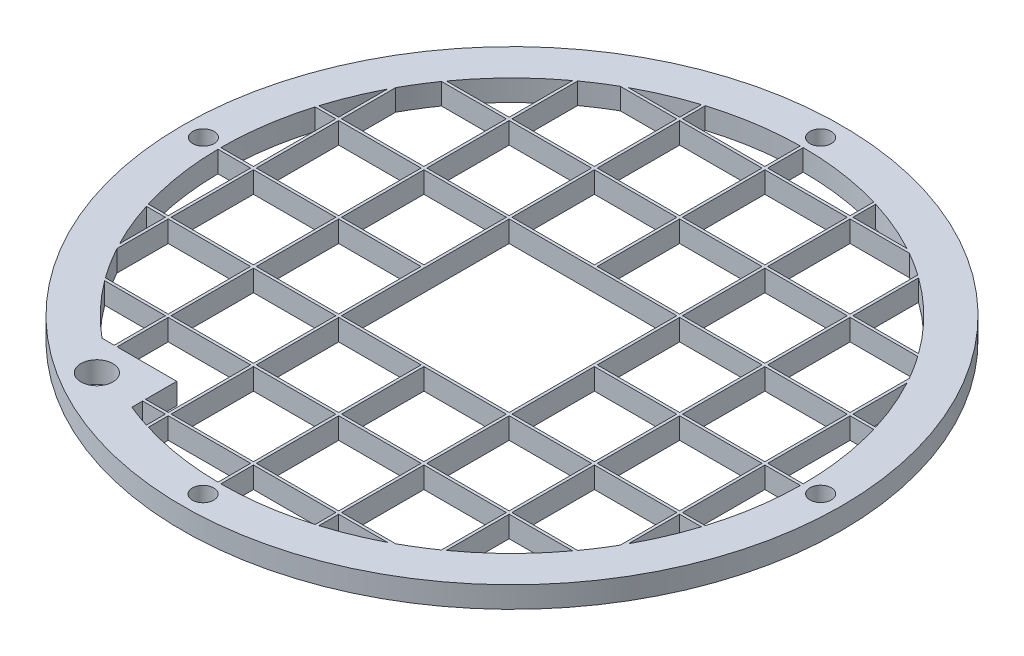
from build123d import *

# Parameters (mm, degrees)
SKETCH2_R                 = 46
SKETCH2_R_2               = 41
BOSS_EXTRUDE2_DEPTH       = 3
EXTRUDE_THIN5_START       = -3
EXTRUDE_THIN5_OUTLINE_R   = 46.4
EXTRUDE_THIN5_OUTLINE_R_2 = 46
EXTRUDE_THIN5_OUTLINE_W   = 11.6
EXTRUDE_THIN5_OUTLINE_H   = 11.6
EXTRUDE_THIN5_OUTLINE_W_2 = 23.6
EXTRUDE_THIN5_OUTLINE_H_2 = 23.6
EXTRUDE_THIN5_DEPTH       = 3
SKETCH5_R                 = 1.5
CUT_EXTRUDE1_DEPTH        = 3
SKETCH6_R                 = 1.5
CUT_EXTRUDE2_DEPTH        = 66.688050664
SKETCH8_W                 = 9.632011236
SKETCH8_H                 = 5.749172176
BOSS_EXTRUDE4_DEPTH       = 3
SKETCH9_R                 = 2.25
CUT_EXTRUDE3_DEPTH        = 66.688050664


# Read off the part's stored shape, not the designer's step: Extrude-Thin5
with BuildPart() as part:
    # Sketch2 → Boss-Extrude2 (new body)
    with BuildSketch(Plane(origin=(0, 0, 0), x_dir=(1, 0, 0), z_dir=(0, 1, 0))):
        with Locations(Location((0, 0, 0), (0, 0, 270))):
            Circle(SKETCH2_R)
        with Locations(Location((0, 0, 0), (0, 0, 270))):
            Circle(SKETCH2_R_2, mode=Mode.SUBTRACT)
    extrude(amount=BOSS_EXTRUDE2_DEPTH)

    # Extrude-Thin5 outline → Extrude-Thin5 (add)
    # profile 1 of 2: a face of its own
    with BuildSketch(Plane(origin=(0, 3, 0), x_dir=(1, 0, 0), z_dir=(0, 1, 0)).offset(EXTRUDE_THIN5_START)):
        Circle(EXTRUDE_THIN5_OUTLINE_R)
        Circle(EXTRUDE_THIN5_OUTLINE_R_2, mode=Mode.SUBTRACT)
    # profile 2 of 2: a face of its own
    with BuildSketch(Plane(origin=(0, 3, 0), x_dir=(1, 0, 0), z_dir=(0, 1, 0)).offset(EXTRUDE_THIN5_START)):
        with BuildLine():
            Line((-24.4, -24.4), (-24.4, -31.6))
            Line((-24.4, -31.6), (-26.123552591, -31.6))
            ThreePointArc((-26.123552591, -31.6), (-25.878554766, -31.800949722), (-25.632011236, -32))
            Line((-25.632011236, -32), (-16, -32))
            Line((-16, -32), (-16, -37.749172176))
            ThreePointArc((-16, -37.749172176), (-15.800220775, -37.833226448), (-15.6, -37.916223441))
            Line((-15.6, -37.916223441), (-15.6, -36.4))
            Line((-15.6, -36.4), (-12.4, -36.4))
            Line((-12.4, -36.4), (-12.4, -39.079918117))
            ThreePointArc((-12.4, -39.079918117), (-12.200159256, -39.142765796), (-12, -39.204591568))
            Line((-12, -39.204591568), (-12, -36.4))
            Line((-12, -36.4), (-0.4, -36.4))
            Line((-0.4, -36.4), (-0.4, -40.998048734))
            ThreePointArc((-0.4, -40.998048734), (-0.20000238, -40.999512181), (0, -41))
            Line((0, -41), (0, -36.4))
            Line((0, -36.4), (11.6, -36.4))
            Line((11.6, -36.4), (11.6, -39.324801335))
            ThreePointArc((11.6, -39.324801335), (11.800153075, -39.265205811), (12, -39.204591568))
            Line((12, -39.204591568), (12, -36.4))
            Line((12, -36.4), (18.869022232, -36.4))
            ThreePointArc((18.869022232, -36.4), (19.246258742, -36.201954705), (19.62141687, -36))
            Line((19.62141687, -36), (12, -36))
            Line((12, -36), (12, -24.4))
            Line((12, -24.4), (23.6, -24.4))
            Line((23.6, -24.4), (23.6, -33.526705773))
            ThreePointArc((23.6, -33.526705773), (23.800427094, -33.384722107), (24, -33.241540277))
            Line((24, -33.241540277), (24, -24.4))
            Line((24, -24.4), (32.94905158, -24.4))
            ThreePointArc((32.94905158, -24.4), (33.095900238, -24.200441885), (33.241540277, -24))
            Line((33.241540277, -24), (24, -24))
            Line((24, -24), (24, -12.4))
            Line((24, -12.4), (35.6, -12.4))
            Line((35.6, -12.4), (35.6, -20.338141508))
            ThreePointArc((35.6, -20.338141508), (35.80179358, -19.980780176), (36, -19.62141687))
            Line((36, -19.62141687), (36, -12.4))
            Line((36, -12.4), (39.079918117, -12.4))
            ThreePointArc((39.079918117, -12.4), (39.142765796, -12.200159256), (39.204591568, -12))
            Line((39.204591568, -12), (36, -12))
            Line((36, -12), (36, -0.4))
            Line((36, -0.4), (40.998048734, -0.4))
            ThreePointArc((40.998048734, -0.4), (40.999512181, -0.20000238), (41, 0))
            Line((41, 0), (36, 0))
            Line((36, 0), (36, 11.6))
            Line((36, 11.6), (39.324801335, 11.6))
            ThreePointArc((39.324801335, 11.6), (39.265205811, 11.800153075), (39.204591568, 12))
            Line((39.204591568, 12), (36, 12))
            Line((36, 12), (36, 19.62141687))
            ThreePointArc((36, 19.62141687), (35.80179358, 19.980780176), (35.6, 20.338141508))
            Line((35.6, 20.338141508), (35.6, 12))
            Line((35.6, 12), (24, 12))
            Line((24, 12), (24, 23.6))
            Line((24, 23.6), (33.526705773, 23.6))
            ThreePointArc((33.526705773, 23.6), (33.384722107, 23.800427094), (33.241540277, 24))
            Line((33.241540277, 24), (24, 24))
            Line((24, 24), (24, 33.241540277))
            ThreePointArc((24, 33.241540277), (23.800427094, 33.384722107), (23.6, 33.526705773))
            Line((23.6, 33.526705773), (23.6, 24))
            Line((23.6, 24), (12, 24))
            Line((12, 24), (12, 35.6))
            Line((12, 35.6), (20.338141508, 35.6))
            ThreePointArc((20.338141508, 35.6), (19.980780176, 35.80179358), (19.62141687, 36))
            Line((19.62141687, 36), (12, 36))
            Line((12, 36), (12, 39.204591568))
            ThreePointArc((12, 39.204591568), (11.800153075, 39.265205811), (11.6, 39.324801335))
            Line((11.6, 39.324801335), (11.6, 36))
            Line((11.6, 36), (0, 36))
            Line((0, 36), (0, 41))
            ThreePointArc((0, 41), (-0.20000238, 40.999512181), (-0.4, 40.998048734))
            Line((-0.4, 40.998048734), (-0.4, 36))
            Line((-0.4, 36), (-12, 36))
            Line((-12, 36), (-12, 39.204591568))
            ThreePointArc((-12, 39.204591568), (-12.200159256, 39.142765796), (-12.4, 39.079918117))
            Line((-12.4, 39.079918117), (-12.4, 36))
            Line((-12.4, 36), (-19.62141687, 36))
            ThreePointArc((-19.62141687, 36), (-19.980780176, 35.80179358), (-20.338141508, 35.6))
            Line((-20.338141508, 35.6), (-12.4, 35.6))
            Line((-12.4, 35.6), (-12.4, 24))
            Line((-12.4, 24), (-24, 24))
            Line((-24, 24), (-24, 33.241540277))
            ThreePointArc((-24, 33.241540277), (-24.200441885, 33.095900238), (-24.4, 32.94905158))
            Line((-24.4, 32.94905158), (-24.4, 24))
            Line((-24.4, 24), (-33.241540277, 24))
            ThreePointArc((-33.241540277, 24), (-33.384722107, 23.800427094), (-33.526705773, 23.6))
            Line((-33.526705773, 23.6), (-24.4, 23.6))
            Line((-24.4, 23.6), (-24.4, 12))
            Line((-24.4, 12), (-36, 12))
            Line((-36, 12), (-36, 19.62141687))
            ThreePointArc((-36, 19.62141687), (-36.201954705, 19.246258742), (-36.4, 18.869022232))
            Line((-36.4, 18.869022232), (-36.4, 12))
            Line((-36.4, 12), (-39.204591568, 12))
            ThreePointArc((-39.204591568, 12), (-39.265205811, 11.800153075), (-39.324801335, 11.6))
            Line((-39.324801335, 11.6), (-36.4, 11.6))
            Line((-36.4, 11.6), (-36.4, 0))
            Line((-36.4, 0), (-41, 0))
            ThreePointArc((-41, 0), (-40.999512181, -0.20000238), (-40.998048734, -0.4))
            Line((-40.998048734, -0.4), (-36.4, -0.4))
            Line((-36.4, -0.4), (-36.4, -12))
            Line((-36.4, -12), (-39.204591568, -12))
            ThreePointArc((-39.204591568, -12), (-39.142765796, -12.200159256), (-39.079918117, -12.4))
            Line((-39.079918117, -12.4), (-36.4, -12.4))
            Line((-36.4, -12.4), (-36.4, -18.869022232))
            ThreePointArc((-36.4, -18.869022232), (-36.201954705, -19.246258742), (-36, -19.62141687))
            Line((-36, -19.62141687), (-36, -12.4))
            Line((-36, -12.4), (-24.4, -12.4))
            Line((-24.4, -12.4), (-24.4, -24))
            Line((-24.4, -24), (-33.241540277, -24))
            ThreePointArc((-33.241540277, -24), (-33.095900238, -24.200441885), (-32.94905158, -24.4))
            Line((-32.94905158, -24.4), (-24.4, -24.4))
        make_face()
        Polygon((-15.6, -36), (-15.6, -31.6), (-24, -31.6), (-24, -24.4), (-12.4, -24.4), (-12.4, -36), align=None, mode=Mode.SUBTRACT)
        with Locations((-6.2, -30.2)):
            Rectangle(EXTRUDE_THIN5_OUTLINE_W, EXTRUDE_THIN5_OUTLINE_H, mode=Mode.SUBTRACT)
        with Locations((-30.2, -6.2)):
            Rectangle(EXTRUDE_THIN5_OUTLINE_W, EXTRUDE_THIN5_OUTLINE_H, mode=Mode.SUBTRACT)
        with Locations((-18.2, -18.2)):
            Rectangle(EXTRUDE_THIN5_OUTLINE_W, EXTRUDE_THIN5_OUTLINE_H, mode=Mode.SUBTRACT)
        with Locations((-6.2, -18.2)):
            Rectangle(EXTRUDE_THIN5_OUTLINE_W, EXTRUDE_THIN5_OUTLINE_H, mode=Mode.SUBTRACT)
        with Locations((-18.2, -6.2)):
            Rectangle(EXTRUDE_THIN5_OUTLINE_W, EXTRUDE_THIN5_OUTLINE_H, mode=Mode.SUBTRACT)
        with Locations((-0.2, -0.2)):
            Rectangle(EXTRUDE_THIN5_OUTLINE_W_2, EXTRUDE_THIN5_OUTLINE_H_2, mode=Mode.SUBTRACT)
        with Locations((5.8, -30.2)):
            Rectangle(EXTRUDE_THIN5_OUTLINE_W, EXTRUDE_THIN5_OUTLINE_H, mode=Mode.SUBTRACT)
        with Locations((5.8, -18.2)):
            Rectangle(EXTRUDE_THIN5_OUTLINE_W, EXTRUDE_THIN5_OUTLINE_H, mode=Mode.SUBTRACT)
        with Locations((17.8, -18.2)):
            Rectangle(EXTRUDE_THIN5_OUTLINE_W, EXTRUDE_THIN5_OUTLINE_H, mode=Mode.SUBTRACT)
        with Locations((17.8, -6.2)):
            Rectangle(EXTRUDE_THIN5_OUTLINE_W, EXTRUDE_THIN5_OUTLINE_H, mode=Mode.SUBTRACT)
        with Locations((29.8, -6.2)):
            Rectangle(EXTRUDE_THIN5_OUTLINE_W, EXTRUDE_THIN5_OUTLINE_H, mode=Mode.SUBTRACT)
        with Locations((-30.2, 5.8)):
            Rectangle(EXTRUDE_THIN5_OUTLINE_W, EXTRUDE_THIN5_OUTLINE_H, mode=Mode.SUBTRACT)
        with Locations((-18.2, 5.8)):
            Rectangle(EXTRUDE_THIN5_OUTLINE_W, EXTRUDE_THIN5_OUTLINE_H, mode=Mode.SUBTRACT)
        with Locations((-18.2, 17.8)):
            Rectangle(EXTRUDE_THIN5_OUTLINE_W, EXTRUDE_THIN5_OUTLINE_H, mode=Mode.SUBTRACT)
        with Locations((-6.2, 17.8)):
            Rectangle(EXTRUDE_THIN5_OUTLINE_W, EXTRUDE_THIN5_OUTLINE_H, mode=Mode.SUBTRACT)
        with Locations((-6.2, 29.8)):
            Rectangle(EXTRUDE_THIN5_OUTLINE_W, EXTRUDE_THIN5_OUTLINE_H, mode=Mode.SUBTRACT)
        with Locations((17.8, 5.8)):
            Rectangle(EXTRUDE_THIN5_OUTLINE_W, EXTRUDE_THIN5_OUTLINE_H, mode=Mode.SUBTRACT)
        with Locations((5.8, 17.8)):
            Rectangle(EXTRUDE_THIN5_OUTLINE_W, EXTRUDE_THIN5_OUTLINE_H, mode=Mode.SUBTRACT)
        with Locations((17.8, 17.8)):
            Rectangle(EXTRUDE_THIN5_OUTLINE_W, EXTRUDE_THIN5_OUTLINE_H, mode=Mode.SUBTRACT)
        with Locations((29.8, 5.8)):
            Rectangle(EXTRUDE_THIN5_OUTLINE_W, EXTRUDE_THIN5_OUTLINE_H, mode=Mode.SUBTRACT)
        with Locations((5.8, 29.8)):
            Rectangle(EXTRUDE_THIN5_OUTLINE_W, EXTRUDE_THIN5_OUTLINE_H, mode=Mode.SUBTRACT)
    extrude(amount=EXTRUDE_THIN5_DEPTH)

    # Sketch5 → Cut-Extrude1 (cut)
    with BuildSketch(Plane.XZ):
        with Locations(Location((0, -43.452428413, 0), (0, 0, 270))):
            Circle(SKETCH5_R)
        with Locations(Location((-43.452428413, 0, 0), (0, 0, 270))):
            Circle(SKETCH5_R)
        with Locations(Location((43.452428413, 0, 0), (0, 0, 270))):
            Circle(SKETCH5_R)
    extrude(amount=-CUT_EXTRUDE1_DEPTH, mode=Mode.SUBTRACT)

    # Sketch6 → Cut-Extrude2 (cut, through all)
    with BuildSketch(Plane(origin=(0, 3, 0), x_dir=(1, 0, 0), z_dir=(0, 1, 0))):
        with Locations(Location((0, -43.5, 0), (0, 0, 270))):
            Circle(SKETCH6_R)
    extrude(amount=-CUT_EXTRUDE2_DEPTH, mode=Mode.SUBTRACT)

    # Sketch8 → Boss-Extrude4 (add, through all)
    with BuildSketch(Plane(origin=(0, 3, 0), x_dir=(1, 0, 0), z_dir=(0, 1, 0))):
        with Locations((-20.816005618, -34.874586088)):
            Rectangle(SKETCH8_W, SKETCH8_H)
    extrude(amount=-BOSS_EXTRUDE4_DEPTH)

    # Sketch9 → Cut-Extrude3 (cut, through all)
    with BuildSketch(Plane(origin=(0, 3, 0), x_dir=(1, 0, 0), z_dir=(0, 1, 0))):
        with Locations(Location((-22.269696024, -36.181232039, 0), (0, 0, 270))):
            Circle(SKETCH9_R)
    extrude(amount=-CUT_EXTRUDE3_DEPTH, mode=Mode.SUBTRACT)


solid = part.part
